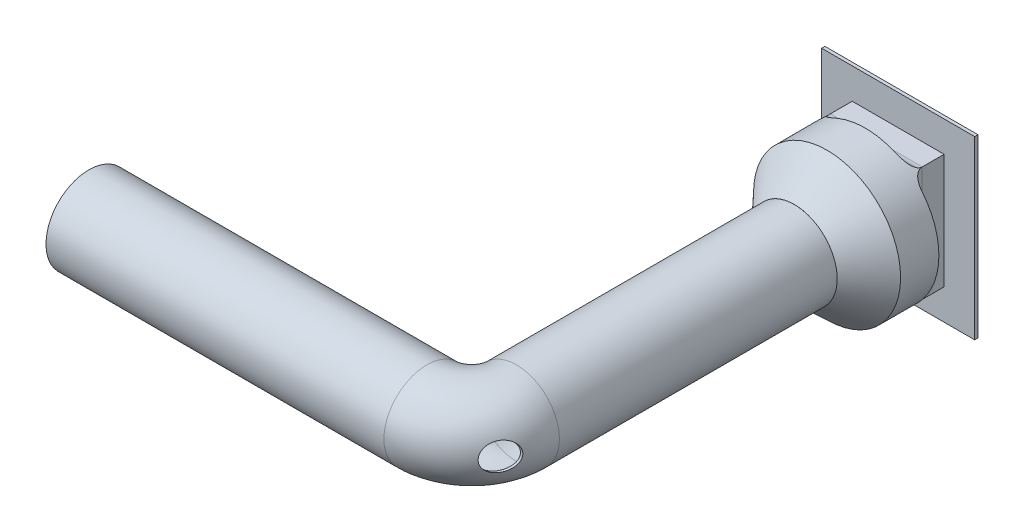
from build123d import *

# Parameters (mm, degrees)
CROQUIS1_W              = 140
CROQUIS1_H              = 161
CROQUIS1_W_2            = 80
CROQUIS1_H_2            = 101
SALIENTE_EXTRUIR1_DEPTH = 3
CROQUIS2_W              = 84
CROQUIS2_H              = 105
CROQUIS2_W_2            = 80
CROQUIS2_H_2            = 101
SALIENTE_EXTRUIR2_DEPTH = 30
CROQUIS3_R              = 67.232804493
CROQUIS3_R_2            = 39.232804493
SALIENTE_EXTRUIR3_DEPTH = 65
CROQUIS6_R              = 39.232804493
CROQUIS6_R_2            = 37.232804493
SALIENTE_EXTRUIR4_DEPTH = 45
CHAFL_N1_SIZE           = 30
CHAFL_N1_SIZE2          = 27.975452584
REDONDEO1_R             = 10
REDONDEO2_R             = 10
REDONDEO3_R             = 10
REDONDEO4_R             = 10
CROQUIS7_R              = 39.232804493
CROQUIS7_R_2            = 37.232804493
CROQUIS8_R              = 12.7
CORTAR_EXTRUIR1_DEPTH   = 120


with BuildPart() as part:
    # Croquis1 → Saliente-Extruir1 (new body)
    with BuildSketch(Plane.XY):
        with Locations((70, -80.5)):
            Rectangle(CROQUIS1_W, CROQUIS1_H)
        with Locations((70, -80.5)):
            Rectangle(CROQUIS1_W_2, CROQUIS1_H_2, mode=Mode.SUBTRACT)
    extrude(amount=SALIENTE_EXTRUIR1_DEPTH)

    # Croquis2 → Saliente-Extruir2 (add)
    with BuildSketch(Plane.XY.offset(3)):
        with Locations((70, -80.5)):
            Rectangle(CROQUIS2_W, CROQUIS2_H)
        with Locations((70, -80.5)):
            Rectangle(CROQUIS2_W_2, CROQUIS2_H_2, mode=Mode.SUBTRACT)
    extrude(amount=SALIENTE_EXTRUIR2_DEPTH)

    # Croquis3 → Saliente-Extruir3 (add)
    with BuildSketch(Plane.XY.offset(33)):
        with Locations(Location((70, -80.5, 0), (0, 0, 128.659808254))):
            Circle(CROQUIS3_R)
        with Locations((70, -80.5)):
            Circle(CROQUIS3_R_2, mode=Mode.SUBTRACT)
    extrude(amount=SALIENTE_EXTRUIR3_DEPTH)

    # Chaflán1
    chafl_n1_edges = [part.edges().sort_by_distance(p)[0] for p in [
        (112, -133, 98),
    ]]
    chafl_n1_side = [part.faces().sort_by_distance(p)[0] for p in [
        (112, -133, 65.5),
    ]]
    chamfer(chafl_n1_edges, length=CHAFL_N1_SIZE, length2=CHAFL_N1_SIZE2, reference=chafl_n1_side[0])

    # Redondeo1
    # the kernel refuses this fillet: 10 mm, written as the material it adds along each edge
    with BuildSketch(Plane(origin=(28, -28, 33), x_dir=(0, 1, 0), z_dir=(1, 0, 0))) as redondeo1_piece_1_section:
        with BuildLine():
            CenterArc((REDONDEO1_R, -REDONDEO1_R), REDONDEO1_R, 90, 90)
            Line((0, -REDONDEO1_R), (0, 0))
            Line((0, 0), (REDONDEO1_R, 0))
        make_face()
    redondeo1_piece_1 = extrude(amount=84, mode=Mode.PRIVATE)
    redondeo1_piece_1 = redondeo1_piece_1 & Plane(origin=(70, -80.5, 30.631973807), x_dir=(-0.6246950475531964, 0.7808688094440126, 0), z_dir=(0, 0, -1)) * Cylinder(67.232804493, 209, mode=Mode.PRIVATE)
    add(redondeo1_piece_1)

    # Redondeo2
    # the kernel refuses this fillet: 10 mm, written as the material it adds along each edge
    with BuildSketch(Plane(origin=(112, -3, 33), x_dir=(0, 0, -1), z_dir=(0, -1, 0))) as redondeo2_piece_1_section:
        with BuildLine():
            CenterArc((REDONDEO2_R, REDONDEO2_R), REDONDEO2_R, 180, 90)
            Line((0, REDONDEO2_R), (0, 0))
            Line((0, 0), (REDONDEO2_R, 0))
        make_face()
    redondeo2_piece_1 = extrude(amount=130, mode=Mode.PRIVATE)
    redondeo2_piece_1 = redondeo2_piece_1 & Plane(origin=(70, -80.5, 30.687304205), x_dir=(-0.6246950475530829, 0.7808688094441035, 0), z_dir=(0, 0, -1)) * Cylinder(67.232804493, 300, mode=Mode.PRIVATE)
    add(redondeo2_piece_1)

    # Redondeo3
    # the kernel refuses this fillet: 10 mm, written as the material it adds along each edge
    with BuildSketch(Plane(origin=(28, -133, 33), x_dir=(-1, 0, 0), z_dir=(0, 1, 0))) as redondeo3_piece_1_section:
        with BuildLine():
            CenterArc((REDONDEO3_R, -REDONDEO3_R), REDONDEO3_R, 90, 90)
            Line((0, -REDONDEO3_R), (0, 0))
            Line((0, 0), (REDONDEO3_R, 0))
        make_face()
    redondeo3_piece_1 = extrude(amount=130, mode=Mode.PRIVATE)
    redondeo3_piece_1 = redondeo3_piece_1 & Plane(origin=(70, -80.5, 30.687304147), x_dir=(-0.6246950475531964, 0.7808688094440126, 0), z_dir=(0, 0, -1)) * Cylinder(67.232804493, 300, mode=Mode.PRIVATE)
    add(redondeo3_piece_1)

    # Redondeo4
    redondeo4_edges = [part.edges().sort_by_distance(p)[0] for p in [
        (70, -133, 33),
    ]]
    fillet(redondeo4_edges, radius=REDONDEO4_R)


with BuildPart() as body_2:
    # Croquis6 → Saliente-Extruir4 (new body)
    with BuildSketch(Plane.XY.offset(98)):
        with Locations(Location((70, -80.5, 0), (0, 0, 180))):
            Circle(CROQUIS6_R)
        with Locations(Location((70, -80.5, 0), (0, 0, 180))):
            Circle(CROQUIS6_R_2, mode=Mode.SUBTRACT)
    extrude(amount=SALIENTE_EXTRUIR4_DEPTH)

    # Barrer1: sweep along a curve in space
    with BuildLine() as barrer1_path:
        Line((70, -80.5, 143), (70, -80.5, 352))
        ThreePointArc((70, -80.5, 352), (57.991378029, -80.5, 380.991378029), (29, -80.5, 393))
        Line((29, -80.5, 393), (-280, -80.5, 393))
    # Croquis7 → Barrer1 (sweep)
    with BuildSketch(Plane.XY.offset(143)):
        with Locations((70, -80.5)):
            Circle(CROQUIS7_R)
        with Locations((70, -80.5)):
            Circle(CROQUIS7_R_2, mode=Mode.SUBTRACT)
    sweep(path=barrer1_path.line)

    # Croquis8 → Cortar-Extruir1 (cut)
    with BuildSketch(Plane(origin=(0, 0, 0), x_dir=(0, 0, -1), z_dir=(1, 0, 0))):
        with Locations(Location((-393, -80.5, 0), (0, 0, 180))):
            Circle(CROQUIS8_R)
    extrude(amount=CORTAR_EXTRUIR1_DEPTH, mode=Mode.SUBTRACT)


solid = Compound([part.part, body_2.part])
